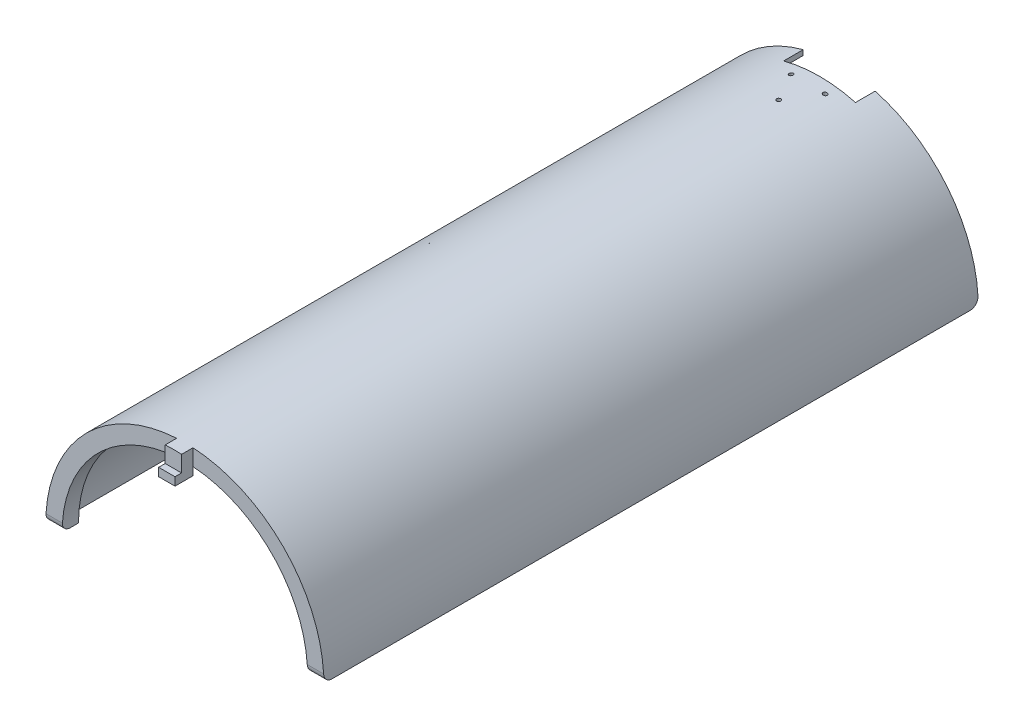
from build123d import *

# Parameters (mm, degrees)
BOSS_EXTRUDE1_DEPTH = 400
BOSS_EXTRUDE3_DEPTH = 60
FILLET4_R           = 10
SKETCH6_R           = 1.25
SKETCH6_W           = 43.954521952
SKETCH6_H           = 12
CUT_EXTRUDE5_DEPTH  = 50
BOSS_EXTRUDE4_START = -10
BOSS_EXTRUDE4_DEPTH = 10
BOSS_EXTRUDE5_DEPTH = 7
SKETCH10_W          = 10
SKETCH10_H          = 5
BOSS_EXTRUDE6_DEPTH = 4
FILLET6_R           = 5
FILLET7_R           = 2


with BuildPart() as part:
    # Sketch1 → Boss-Extrude1 (new body)
    with BuildSketch(Plane.XY):
        with BuildLine():
            Line((-85, 0), (-82, 0))
            ThreePointArc((-82, 0), (0, 82), (82, 0))
            Line((82, 0), (85, 0))
            ThreePointArc((85, 0), (0, 85), (-85, 0))
        make_face()
    extrude(amount=BOSS_EXTRUDE1_DEPTH)

    # Sketch5 → Boss-Extrude3 (add)
    with BuildSketch(Plane(origin=(0, 0, 0), x_dir=(-1, 0, 0), z_dir=(0, 0, -1))):
        with BuildLine():
            Line((-21.977260976, 79), (21.977260976, 79))
            ThreePointArc((21.977260976, 79), (0, 82), (-21.977260976, 79))
        make_face()
    extrude(amount=-BOSS_EXTRUDE3_DEPTH)

    # Fillet4
    # the kernel refuses this fillet: 10 mm, written as the material it takes off along each edge
    with BuildSketch(Plane(origin=(46.977260976, 79, 60), x_dir=(0, 0, -1), z_dir=(-1, 0, 0))) as fillet4_piece_1_section:
        with BuildLine():
            CenterArc((FILLET4_R, -FILLET4_R), FILLET4_R, 90, 90)
            Line((0, -FILLET4_R), (0, 0))
            Line((0, 0), (FILLET4_R, 0))
        make_face()
    fillet4_piece_1 = extrude(amount=93.954521952, mode=Mode.PRIVATE)
    fillet4_piece_1 = fillet4_piece_1 & Plane(origin=(0, 0, 56.767461198), x_dir=(-1, 0, 0), z_dir=(0, 0, -1)) * Cylinder(82, 228, mode=Mode.PRIVATE)
    add(fillet4_piece_1, mode=Mode.SUBTRACT)

    # Sketch6 → Cut-Extrude5 (cut)
    with BuildSketch(Plane.XZ.offset(-79)):
        with Locations(Location((0, 37, 0), (0, 0, 270))):
            Circle(SKETCH6_R)
        with Locations(Location((10.392304845, 19, 0), (0, 0, 270))):
            Circle(SKETCH6_R)
        with Locations(Location((-10.392304845, 19, 0), (0, 0, 270))):
            Circle(SKETCH6_R)
        with Locations((0, 6)):
            Rectangle(SKETCH6_W, SKETCH6_H)
    extrude(amount=-CUT_EXTRUDE5_DEPTH, mode=Mode.SUBTRACT)

    # Sketch7 → Boss-Extrude4 (add)
    with BuildSketch(Plane.XY.offset(400).offset(BOSS_EXTRUDE4_START)):
        with BuildLine():
            Line((-75, 0), (-82, 0))
            ThreePointArc((-82, 0), (0, 82), (82, 0))
            Line((82, 0), (75, 0))
            ThreePointArc((75, 0), (0, 75), (-75, 0))
        make_face()
    extrude(amount=BOSS_EXTRUDE4_DEPTH)

    # Sketch9 → Boss-Extrude5 (add)
    with BuildSketch(Plane.XY.offset(400)):
        with BuildLine():
            Line((-5, 84.852813742), (-5, 80))
            Line((-5, 80), (-5, 74.833147735))
            Line((-5, 74.833147735), (-5, 70))
            Line((-5, 70), (5, 70))
            Line((5, 70), (5, 74.833147735))
            Line((5, 74.833147735), (5, 80))
            Line((5, 80), (5, 84.852813742))
            ThreePointArc((5, 84.852813742), (0, 85), (-5, 84.852813742))
        make_face()
    extrude(amount=BOSS_EXTRUDE5_DEPTH)

    # Sketch10 → Boss-Extrude6 (add)
    with BuildSketch(Plane.XY.offset(407)):
        with Locations((0, 72.5)):
            Rectangle(SKETCH10_W, SKETCH10_H)
    extrude(amount=BOSS_EXTRUDE6_DEPTH)

    # Fillet6
    fillet6_edges = [part.edges().sort_by_distance(p)[0] for p in [
        (80, 0, 400),
        (83.5, 0, 0),
        (-83.5, 0, 0),
        (-80, 0, 400),
    ]]
    fillet(fillet6_edges, radius=FILLET6_R)

    # Fillet7
    fillet7_edges = [part.edges().sort_by_distance(p)[0] for p in [
        (0, 79, 12),
    ]]
    fillet(fillet7_edges, radius=FILLET7_R)


solid = part.part
